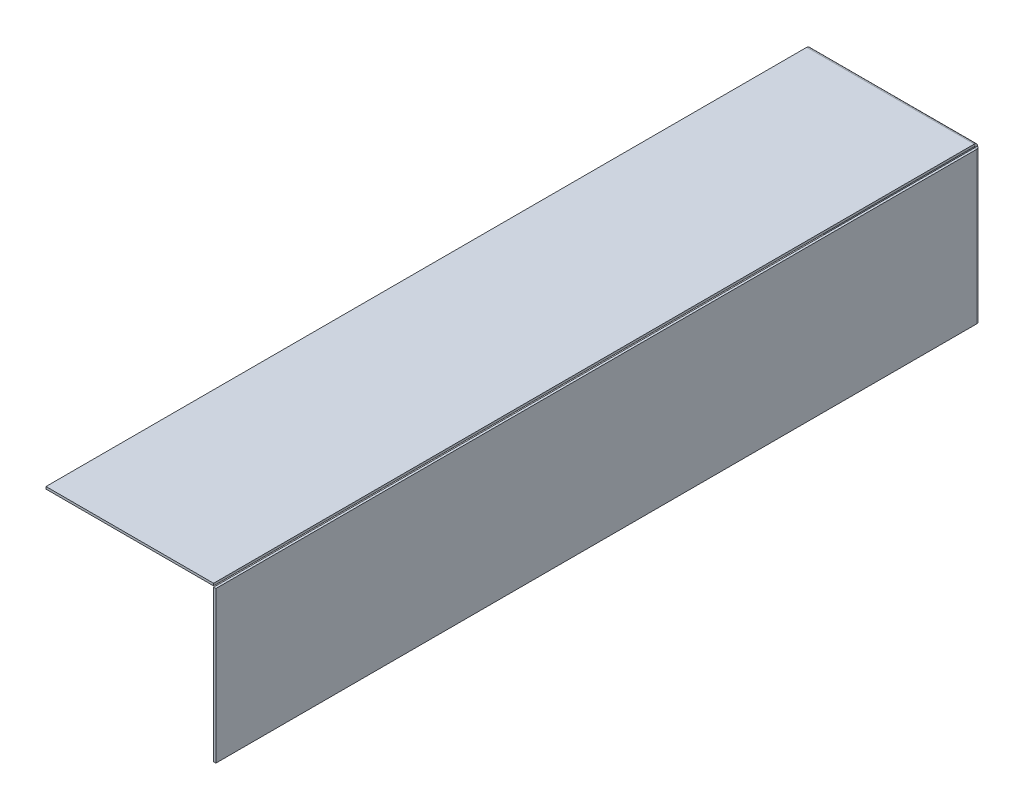
from build123d import *

# Parameters (mm, degrees)
TABAN_FLAN_2_DEPTH            = 1.5
KENAR_FLAN_2_STRIP_W          = 7.4732
KENAR_FLAN_2_STRIP_H          = 1.5
KENAR_FLAN_2_STRIP_CUT_DEPTH  = 110
KENAR_FLAN_2_RELIEF_W         = 8.2232
KENAR_FLAN_2_RELIEF_H         = 0.75
KENAR_FLAN_2_RELIEF_CUT_DEPTH = 1.5
KENAR_FLAN_2_DEPTH            = 110
KENAR_FLAN_4_STRIP_W          = 7.4732
KENAR_FLAN_4_STRIP_H          = 1.5
KENAR_FLAN_4_STRIP_CUT_DEPTH  = 99.2634
KENAR_FLAN_4_DEPTH            = 99.2634


# Sheet-metal steps are written as plain solids
with BuildPart() as part:
    # Çizim1 → Taban-Flanş2 (new body)
    with BuildSketch(Plane.XY):
        Polygon((0, 0), (0, 70), (30, 100), (140, 100), (140, 0), align=None)
    extrude(amount=-TABAN_FLAN_2_DEPTH)

    # Kenar-Flanş2 strip (across the edge) → Kenar-Flanş2 strip cut (cut)
    with BuildSketch(Plane(origin=(140, 100, 0), x_dir=(0, -1, 0), z_dir=(-1, 0, 0))):
        with Locations((-3, -0.75)):
            Rectangle(KENAR_FLAN_2_STRIP_W, KENAR_FLAN_2_STRIP_H)
    extrude(amount=KENAR_FLAN_2_STRIP_CUT_DEPTH, mode=Mode.SUBTRACT)

    # Kenar-Flanş2 relief (on the sheet) → Kenar-Flanş2 relief cut (cut)
    with BuildSketch(Plane(origin=(140, 99.2634, 0), x_dir=(0, -1, 0), z_dir=(0, 0, 1))):
        with Locations((-3.3616, -110.375)):
            Rectangle(KENAR_FLAN_2_RELIEF_W, KENAR_FLAN_2_RELIEF_H)
    extrude(amount=-KENAR_FLAN_2_RELIEF_CUT_DEPTH, mode=Mode.SUBTRACT)

    # Kenar-Flanş2 section (across the edge) → Kenar-Flanş2 (add)
    with BuildSketch(Plane(origin=(140, 100, 0), x_dir=(0, -1, 0), z_dir=(-1, 0, 0))):
        with BuildLine():
            Line((-1.5, 0.7366), (-1.5, 500))
            Line((-1.5, 500), (0, 500))
            Line((0, 500), (0, 0.7366))
            ThreePointArc((0, 0.7366), (0.215745145, 0.215745145), (0.7366, 0))
            Line((0.7366, 0), (0.7366, -1.5))
            ThreePointArc((0.7366, -1.5), (-0.844915027, -0.844915027), (-1.5, 0.7366))
        make_face()
    extrude(amount=KENAR_FLAN_2_DEPTH)

    # Kenar-Flanş4 strip (across the edge) → Kenar-Flanş4 strip cut (cut)
    with BuildSketch(Plane(origin=(140, 0, 0), x_dir=(-1, 0, 0), z_dir=(0, 1, 0))):
        with Locations((-3, -0.75)):
            Rectangle(KENAR_FLAN_4_STRIP_W, KENAR_FLAN_4_STRIP_H)
    extrude(amount=KENAR_FLAN_4_STRIP_CUT_DEPTH, mode=Mode.SUBTRACT)

    # Kenar-Flanş4 section (across the edge) → Kenar-Flanş4 (add)
    with BuildSketch(Plane(origin=(140, 0, 0), x_dir=(-1, 0, 0), z_dir=(0, 1, 0))):
        with BuildLine():
            Line((-1.5, 0.7366), (-1.5, 500))
            Line((-1.5, 500), (0, 500))
            Line((0, 500), (0, 0.7366))
            ThreePointArc((0, 0.7366), (0.215745145, 0.215745145), (0.7366, 0))
            Line((0.7366, 0), (0.7366, -1.5))
            ThreePointArc((0.7366, -1.5), (-0.844915027, -0.844915027), (-1.5, 0.7366))
        make_face()
    extrude(amount=KENAR_FLAN_4_DEPTH)


solid = part.part
